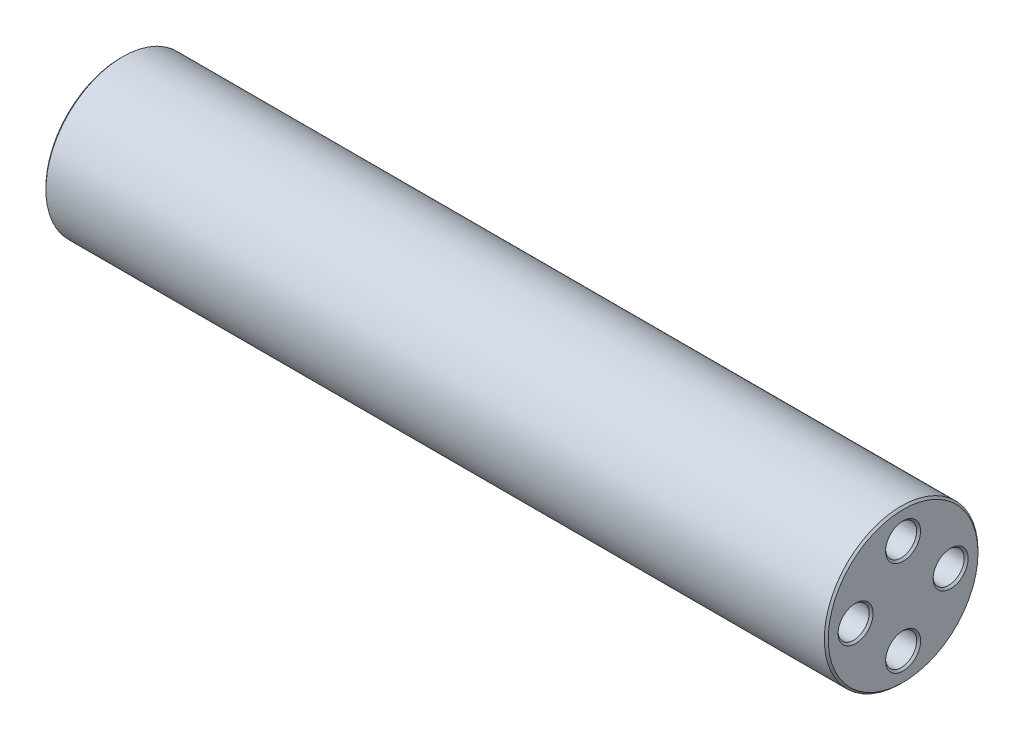
from build123d import *

# Parameters (mm, degrees)
SKETCH2_R                            = 9.980949939
BOSS_EXTRUDE1_DEPTH                  = 50.8
F_10_32_TAPPED_HOLE1_D               = 4.0386
F_10_32_TAPPED_HOLE1_DEPTH           = 11.938
F_10_32_TAPPED_HOLE1_TIP             = 1.213317848
F_10_32_TAPPED_HOLE1_ON_FACE_2_D     = 4.0386
F_10_32_TAPPED_HOLE1_ON_FACE_2_DEPTH = 11.938
F_10_32_TAPPED_HOLE1_ON_FACE_2_TIP   = 1.213317848
CHAMFER1_SIZE                        = 0.254


with BuildPart() as part:
    # Sketch2 → Boss-Extrude1 (new, symmetric)
    with BuildSketch(Plane(origin=(0, 0, 0), x_dir=(0, 0, -1), z_dir=(1, 0, 0))):
        Circle(SKETCH2_R)
    extrude(amount=BOSS_EXTRUDE1_DEPTH, both=True)

    # #10-32 Tapped Hole1
    with Locations(Plane(origin=(50.8, 0, 6.170949939), x_dir=(0, 0, 1), z_dir=(1, 0, 0))):
        with Locations((0, 0), (-6.170949939, 6.170949939), (-12.341899878, 0), (-6.170949939, -6.170949939)):
            Hole(F_10_32_TAPPED_HOLE1_D / 2, depth=F_10_32_TAPPED_HOLE1_DEPTH)
            with Locations((0, 0, -(F_10_32_TAPPED_HOLE1_DEPTH + F_10_32_TAPPED_HOLE1_TIP / 2))):  # 118° drill point
                Cone(0, F_10_32_TAPPED_HOLE1_D / 2, F_10_32_TAPPED_HOLE1_TIP, mode=Mode.SUBTRACT)

    # #10-32 Tapped Hole1 on face 2
    with Locations(Plane(origin=(-50.8, 6.170949939, 0), x_dir=(0, 0, -1), z_dir=(-1, 0, 0))):
        with Locations((0, 0), (-6.170949939, 6.170949939), (0, 12.341899878), (6.170949939, 6.170949939)):
            Hole(F_10_32_TAPPED_HOLE1_ON_FACE_2_D / 2, depth=F_10_32_TAPPED_HOLE1_ON_FACE_2_DEPTH)
            with Locations((0, 0, -(F_10_32_TAPPED_HOLE1_ON_FACE_2_DEPTH + F_10_32_TAPPED_HOLE1_ON_FACE_2_TIP / 2))):  # 118° drill point
                Cone(0, F_10_32_TAPPED_HOLE1_ON_FACE_2_D / 2, F_10_32_TAPPED_HOLE1_ON_FACE_2_TIP, mode=Mode.SUBTRACT)

    # Chamfer1
    chamfer1_edges = [part.edges().sort_by_distance(p)[0] for p in [
        (50.8, 0, 9.980949939),
        (50.8, 0, 8.190249939),
        (-50.8, 0, 9.980949939),
        (-50.8, 6.170949939, -2.0193),
        (50.8, 6.170949939, 2.0193),
        (50.8, 0, -4.151649939),
        (50.8, -6.170949939, 2.0193),
        (-50.8, 0, -8.190249939),
        (-50.8, -6.170949939, -2.0193),
        (-50.8, 0, 4.151649939),
    ]]
    chamfer(chamfer1_edges, length=CHAMFER1_SIZE)


solid = part.part
